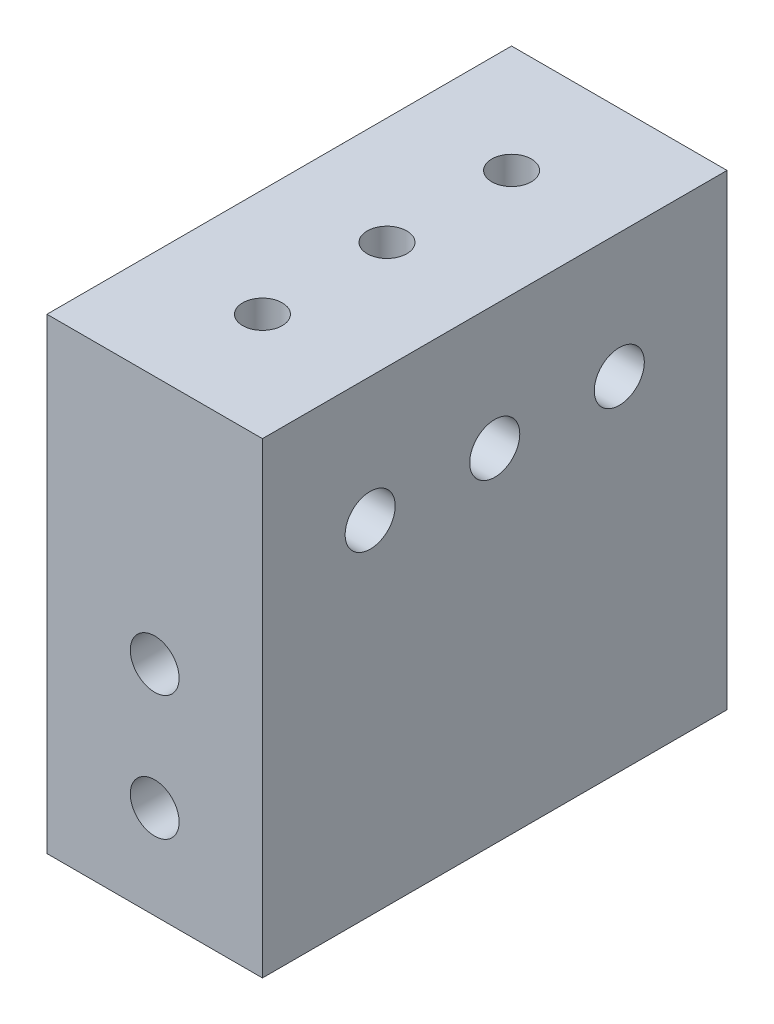
from build123d import *

# Parameters (mm, degrees)
SKETCH1_W              = 21.971
SKETCH1_H              = 47.371
BOSS_EXTRUDE1_DEPTH    = 23.8125
SKETCH2_R              = 2.5527
CUT_EXTRUDE1_DEPTH     = 41.134310851
SKETCH5_R              = 2.4892
CUT_EXTRUDE2_DEPTH     = 55.145433856
F_10_32_TAPPED_HOLE1_D = 4.0386


with BuildPart() as part:
    # Sketch1 → Boss-Extrude1 (new, symmetric)
    with BuildSketch(Plane(origin=(0, 0, 0), x_dir=(1, 0, 0), z_dir=(0, 1, 0))):
        Rectangle(SKETCH1_W, SKETCH1_H)
    extrude(amount=BOSS_EXTRUDE1_DEPTH, both=True)

    # Sketch2 → Cut-Extrude1 (cut, through all)
    with BuildSketch(Plane(origin=(10.9855, 0, 0), x_dir=(0, 0, -1), z_dir=(1, 0, 0))):
        with Locations((-12.7, 11.1125)):
            Circle(SKETCH2_R)
        with Locations((0, 11.1125)):
            Circle(SKETCH2_R)
        with Locations((12.7, 11.1125)):
            Circle(SKETCH2_R)
    extrude(amount=-CUT_EXTRUDE1_DEPTH, mode=Mode.SUBTRACT)

    # Sketch5 → Cut-Extrude2 (cut, through all)
    with BuildSketch(Plane(origin=(0, 0, -23.6855), x_dir=(-1, 0, 0), z_dir=(0, 0, -1))):
        with Locations((0, -1.5875)):
            Circle(SKETCH5_R)
        with Locations((0, -14.2875)):
            Circle(SKETCH5_R)
    extrude(amount=-CUT_EXTRUDE2_DEPTH, mode=Mode.SUBTRACT)

    # #10-32 Tapped Hole1 (through all)
    with Locations(Plane(origin=(0, 23.8125, 12.7), x_dir=(0, 0, 1), z_dir=(0, 1, 0))):
        with Locations((0, 0), (-25.4, 0), (-12.7, 0)):
            Hole(F_10_32_TAPPED_HOLE1_D / 2)


solid = part.part
